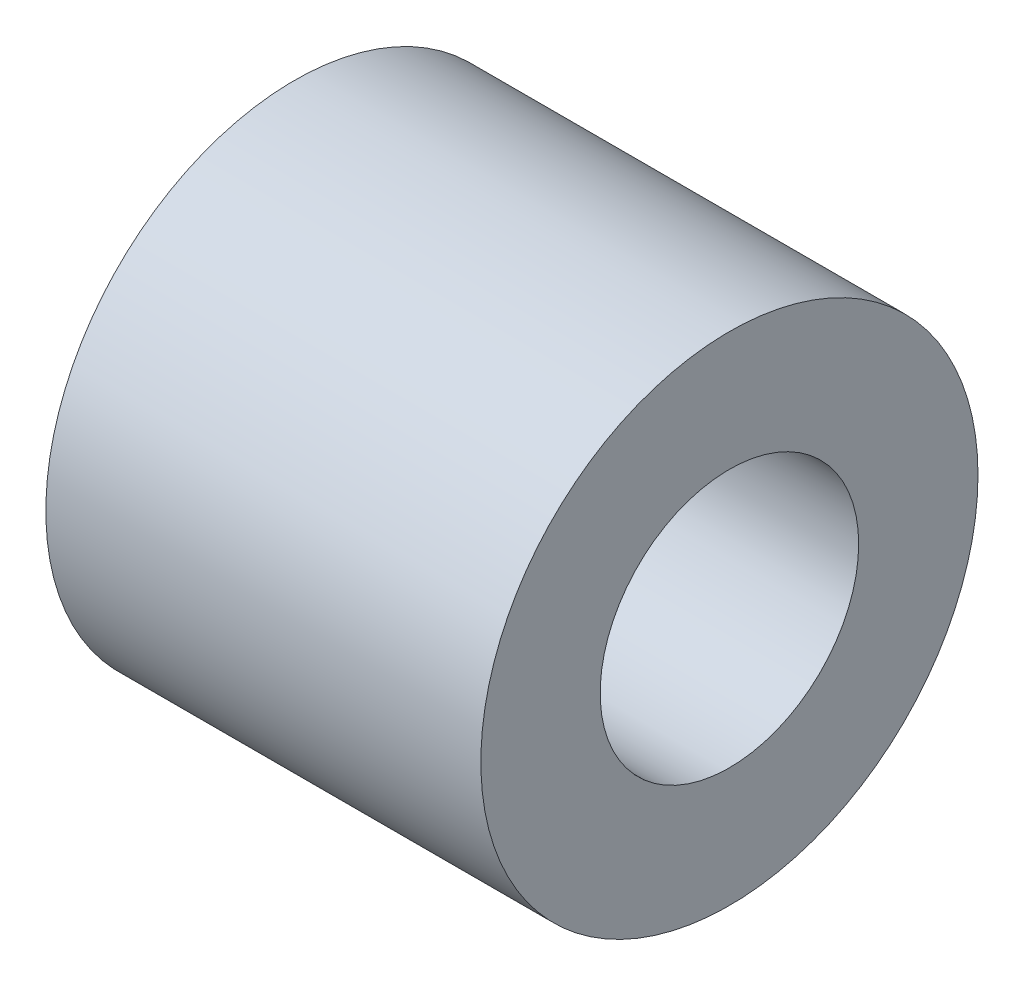
from build123d import *

# Parameters (mm, degrees)
SKETCH1_R           = 6.35
SKETCH1_R_2         = 3.302
BOSS_EXTRUDE1_DEPTH = 11.1125


with BuildPart() as part:
    # Sketch1 → Boss-Extrude1 (new body)
    with BuildSketch(Plane(origin=(0, 0, 0), x_dir=(0, 0, -1), z_dir=(1, 0, 0))):
        Circle(SKETCH1_R)
        Circle(SKETCH1_R_2, mode=Mode.SUBTRACT)
    extrude(amount=BOSS_EXTRUDE1_DEPTH)


solid = part.part
